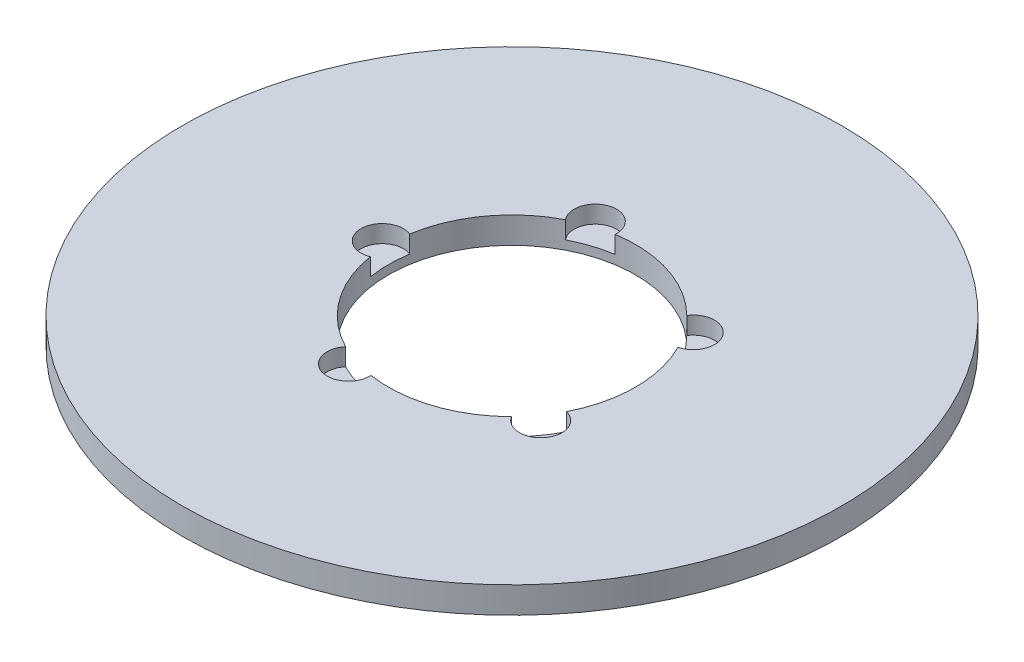
from build123d import *

# Parameters (mm, degrees)
SKETCH1_R           = 100
BOSS_EXTRUDE1_DEPTH = 8
SKETCH2_R           = 37.5
CUT_EXTRUDE1_DEPTH  = 142.647449677
SKETCH3_R           = 6.439026047
CUT_EXTRUDE2_DEPTH  = 5.287156795
CIRPATTERN1_COUNT   = 5


with BuildPart() as part:
    # Sketch1 → Boss-Extrude1 (new body)
    with BuildSketch(Plane(origin=(0, 0, 0), x_dir=(1, 0, 0), z_dir=(0, 1, 0))):
        Circle(SKETCH1_R)
    extrude(amount=BOSS_EXTRUDE1_DEPTH)

    # Sketch2 → Cut-Extrude1 (cut, through all)
    with BuildSketch(Plane(origin=(0, 0, 0), x_dir=(1, 0, 0), z_dir=(0, 1, 0))):
        Circle(SKETCH2_R)
    extrude(amount=CUT_EXTRUDE1_DEPTH, mode=Mode.SUBTRACT)

    # Sketch3 → Cut-Extrude2 (cut)
    with BuildSketch(Plane(origin=(0, 8, 0), x_dir=(1, 0, 0), z_dir=(0, 1, 0))):
        with Locations((-39.378209451, 0)):
            Circle(SKETCH3_R)
    cut_extrude2 = extrude(amount=-CUT_EXTRUDE2_DEPTH, mode=Mode.SUBTRACT)

    # CirPattern1: Cut-Extrude2 ×5 about axis
    cirpattern1_axis = Axis((0, 0, 0), (0, 1, 0))
    for i in range(1, CIRPATTERN1_COUNT):
        add(cut_extrude2.rotate(cirpattern1_axis, i * 360 / CIRPATTERN1_COUNT), mode=Mode.SUBTRACT)


solid = part.part
